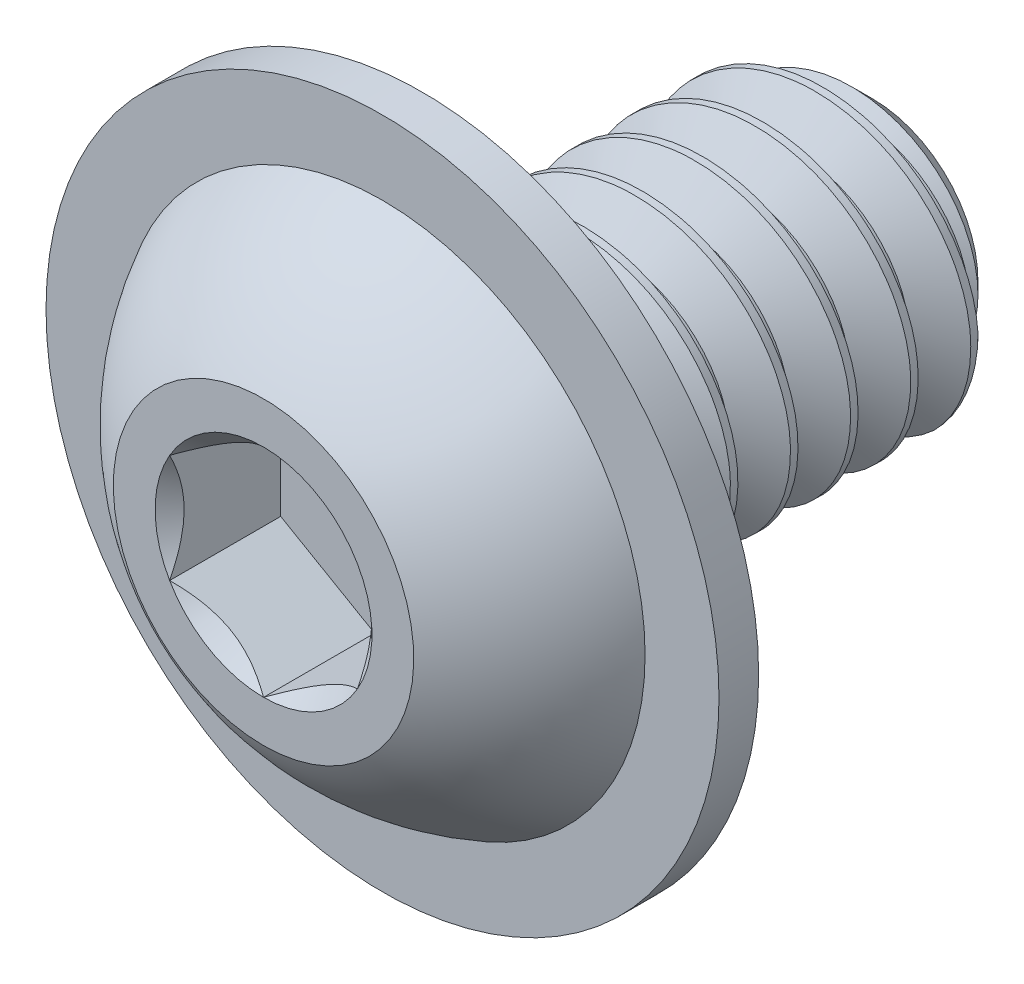
from build123d import *

# Parameters (mm, degrees)
SKETCH1_W           = 9.525
SKETCH1_H           = 3.175
CHAMFER1_SIZE       = 0.9525
CUT_SWEEP1_PITCH    = 1.27
SKETCH11_R          = 7.112
BOSS_EXTRUDE3_DEPTH = 0.8382
CUT_EXTRUDE2_DEPTH  = 2.34696


with BuildPart() as part:
    # Sketch1 → Revolve1 (revolve)
    with BuildSketch(Plane(origin=(0, 0, 0), x_dir=(0, 0, -1), z_dir=(1, 0, 0))):
        with Locations((8.1153, 1.5875)):
            Rectangle(SKETCH1_W, SKETCH1_H)
    revolve(axis=Axis((0, 0, -12.8778), (0, 0, 1)))

    # Chamfer1
    chamfer1_edges = [part.edges().sort_by_distance(p)[0] for p in [
        (0, -3.175, -12.8778),
    ]]
    chamfer(chamfer1_edges, length=CHAMFER1_SIZE)

    # Cut-Sweep1: the profile of Sketch2 profile screwed along a right-hand helix of 8.5 turns, 8 arcs to a turn; built about Z, then put on its axis
    cut_sweep1_z = Axis((0, 0, 0), (0, 0, 1))
    cut_sweep1_corners = [(3.1753, 0, 0.000173205), (3.1753, 0, -1.111423205), (2.350110803, 0, -0.635), (2.350110803, 0, -0.47625)]
    with BuildLine(mode=Mode.PRIVATE) as cut_sweep1_profile:
        Line(cut_sweep1_corners[0], cut_sweep1_corners[1])
        Line(cut_sweep1_corners[1], cut_sweep1_corners[2])
        Line(cut_sweep1_corners[2], cut_sweep1_corners[3])
        Line(cut_sweep1_corners[3], cut_sweep1_corners[0])
    cut_sweep1_cap = Face(cut_sweep1_profile.wire())
    cut_sweep1_turn_angles = [0, 22.5, 45, 67.5, 90, 112.5, 135, 157.5, 180, 202.5, 225, 247.5, 270, 292.5, 315, 337.5, 360]
    cut_sweep1_turn_weights = [1, 0.9238795325112867, 1, 0.9238795325112867, 1, 0.9238795325112867, 1, 0.9238795325112867, 1, 0.9238795325112867, 1, 0.9238795325112867, 1, 0.9238795325112867, 1, 0.9238795325112867, 1]
    cut_sweep1_turn_rails = [Edge.make_bspline([Vector(p[0], p[1], 0).rotate(cut_sweep1_z, cut_sweep1_turn_angles[k]) / cut_sweep1_turn_weights[k] + Vector(0, 0, p[2] + CUT_SWEEP1_PITCH * cut_sweep1_turn_angles[k] / 360) for k in range(17)], [0, 0, 0, 1, 1, 2, 2, 3, 3, 4, 4, 5, 5, 6, 6, 7, 7, 8, 8, 8], 2, cut_sweep1_turn_weights) for p in cut_sweep1_corners]
    cut_sweep1_turn_sides = [Face.make_surface_from_curves(cut_sweep1_turn_rails[p[0]], cut_sweep1_turn_rails[p[1]]) for p in [(0, 1), (1, 2), (2, 3), (3, 0)]]
    cut_sweep1_last_angles = [2880, 2902.5, 2925, 2947.5, 2970, 2992.5, 3015, 3037.5, 3060]
    cut_sweep1_last_weights = [1, 0.9238795325112867, 1, 0.9238795325112867, 1, 0.9238795325112867, 1, 0.9238795325112913, 1]
    cut_sweep1_last_rails = [Edge.make_bspline([Vector(p[0], p[1], 0).rotate(cut_sweep1_z, cut_sweep1_last_angles[k]) / cut_sweep1_last_weights[k] + Vector(0, 0, p[2] + CUT_SWEEP1_PITCH * cut_sweep1_last_angles[k] / 360) for k in range(9)], [0, 0, 0, 1, 1, 2, 2, 3, 3, 4, 4, 4], 2, cut_sweep1_last_weights) for p in cut_sweep1_corners]
    cut_sweep1_last_sides = [Face.make_surface_from_curves(cut_sweep1_last_rails[p[0]], cut_sweep1_last_rails[p[1]]) for p in [(0, 1), (1, 2), (2, 3), (3, 0)]]
    cut_sweep1 = Plane(origin=(0, 0, -12.8778), x_dir=(0, 1, 0), z_dir=(0, 0, 1)) * Solid(Shell([*[p.moved(Location((0, 0, CUT_SWEEP1_PITCH * i))) for i in range(8) for p in cut_sweep1_turn_sides], *cut_sweep1_last_sides, cut_sweep1_cap, cut_sweep1_cap.rotate(cut_sweep1_z, 3060).moved(Location((0, 0, CUT_SWEEP1_PITCH * 3060 / 360)))]))
    add(cut_sweep1, mode=Mode.SUBTRACT)

    # Sketch7 → Revolve2 (revolve)
    with BuildSketch(Plane(origin=(0, 0, 0), x_dir=(0, 0, -1), z_dir=(1, 0, 0)), mode=Mode.PRIVATE) as revolve2_sk:
        with BuildLine():
            Line((2.5146, 5.5499), (3.3528, 5.5499))
            Line((3.3528, 5.5499), (3.3528, 0))
            Line((3.3528, 0), (0, 0))
            Line((0, 0), (0, 3.175))
            ThreePointArc((0, 3.175), (1.089595864, 4.540019085), (2.5146, 5.5499))
        make_face()
    revolve(revolve2_sk.sketch.rotate(Axis((0, 0, 0), (0, 0, -1)), 189.052465709), axis=Axis((0, 0, 0), (0, 0, -1)))

    # Sketch11 → Boss-Extrude3 (add)
    with BuildSketch(Plane(origin=(0, 0, -3.3528), x_dir=(-1, 0, 0), z_dir=(0, 0, -1))):
        Circle(SKETCH11_R)
    extrude(amount=-BOSS_EXTRUDE3_DEPTH)

    # Sketch5 → Cut-Extrude2 (cut)
    with BuildSketch(Plane.XY):
        Polygon((1.984375, -1.14567944), (1.984375, 1.14567944), (0, 2.291358881), (-1.984375, 1.14567944), (-1.984375, -1.14567944), (0, -2.291358881), align=None)
    extrude(amount=-CUT_EXTRUDE2_DEPTH, mode=Mode.SUBTRACT)

    # Cut-Extrude3 cone 1 section (through the dimple's axis) → Cut-Extrude3 (revolve, cut)
    with BuildSketch(Plane(origin=(0, 0, 0), x_dir=(0, -1, 0), z_dir=(1, 0, 0))):
        Polygon((0, 0), (2.291358881, 0), (0, 2.291358881), align=None)
    revolve(axis=Axis((0, 0, 0), (0, 0, -1)), mode=Mode.SUBTRACT)


solid = part.part
